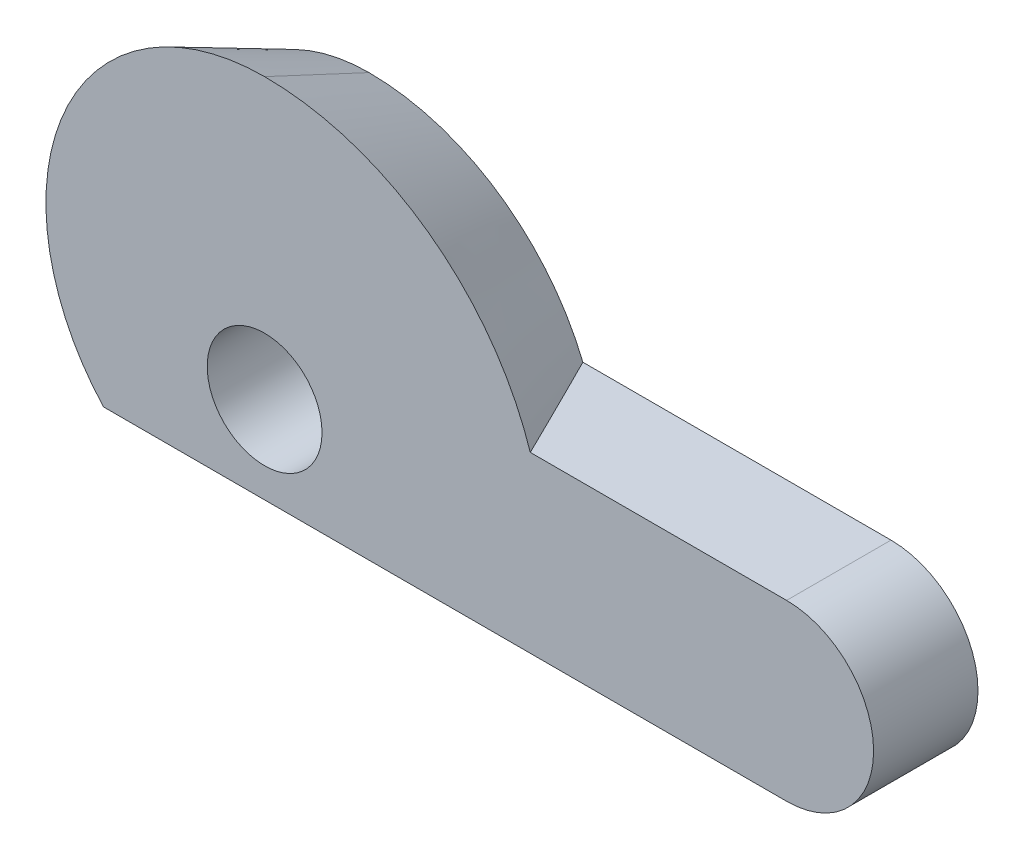
from build123d import *

# Parameters (mm, degrees)
ESBO_O2_R                = 1.65
RESSALTO_EXTRUS_O1_DEPTH = 3
CHANFRO1_SIZE            = 4
CHANFRO1_SIZE_2          = 1.865230633
ESBO_O3_W                = 16.82142479
ESBO_O3_H                = 3.834770965
CORTE_EXTRUS_O1_DEPTH    = 5


with BuildPart() as part:
    # Esboço2 → Ressalto-extrusão1 (new body)
    with BuildSketch(Plane.XY):
        with BuildLine():
            Line((15, 2.5), (8.124038405, 2.5))
            ThreePointArc((8.124038405, 2.5), (5.049752469, 6.837397166), (0, 8.5))
            ThreePointArc((0, 8.5), (-6.75, 1.75), (0, -5))
            ThreePointArc((0, -5), (2.5, -4.330127019), (4.330127019, -2.5))
            Line((4.330127019, -2.5), (15, -2.5))
            ThreePointArc((15, -2.5), (17.5, 0), (15, 2.5))
        make_face()
        Circle(ESBO_O2_R, mode=Mode.SUBTRACT)
    extrude(amount=RESSALTO_EXTRUS_O1_DEPTH)

    # Chanfro1
    # the kernel refuses this chamfer: 4, 1.865230633 mm, written as the material it takes off along each edge
    with BuildSketch(Plane(origin=(0, 0, 0), x_dir=(0.6049671971575049, -0.7962503942626293, 0), z_dir=(-0.7962503942626293, -0.6049671971575049, 0))) as chanfro1_piece_1_section:
        Polygon((8.5, CHANFRO1_SIZE), (8.5 - CHANFRO1_SIZE_2, 0), (8.5, 0), align=None)
    chanfro1_piece_1 = revolve(axis=Axis((0, 0, 0), (0, 0, 1)), revolution_arc=142.773518556, mode=Mode.PRIVATE)
    chanfro1_piece_1 = split(chanfro1_piece_1, bisect_by=Plane(origin=(6.168513844, 2.5, 1.415637253), z_dir=(0, 1, 0)), keep=Keep.TOP, mode=Mode.PRIVATE)
    add(chanfro1_piece_1, mode=Mode.SUBTRACT)
    with BuildSketch(Plane(origin=(0, 0, 0), x_dir=(0, -1, 0), z_dir=(-1, 0, 0))) as chanfro1_piece_2_section:
        Polygon((5, CHANFRO1_SIZE), (5 - CHANFRO1_SIZE_2, 0), (5, 0), align=None)
    chanfro1_piece_2 = revolve(axis=Axis((0, 0, 0), (0, 0, 1)), revolution_arc=178.782767485, mode=Mode.PRIVATE)
    chanfro1_piece_2 = split(chanfro1_piece_2, bisect_by=Plane(origin=(1.977914481, -2.5, 1.262439035), z_dir=(0, -1, 0)), keep=Keep.TOP, mode=Mode.PRIVATE)
    add(chanfro1_piece_2, mode=Mode.SUBTRACT)
    with BuildSketch(Plane(origin=(0, 1.75, 0), x_dir=(0, 1, 0), z_dir=(1, 0, 0))) as chanfro1_piece_3:
        Polygon((6.75, CHANFRO1_SIZE), (6.75 - CHANFRO1_SIZE_2, 0), (6.75, 0), align=None)
    revolve(axis=Axis((0, 1.75, 0), (0, 0, 1)), revolution_arc=180, mode=Mode.SUBTRACT)

    # Esboço3 → Corte-extrusão1 (cut)
    with BuildSketch(Plane.XY.offset(3)):
        with Locations((-0.707373788, -4.417385483)):
            Rectangle(ESBO_O3_W, ESBO_O3_H)
    extrude(amount=-CORTE_EXTRUS_O1_DEPTH, mode=Mode.SUBTRACT)


solid = part.part
